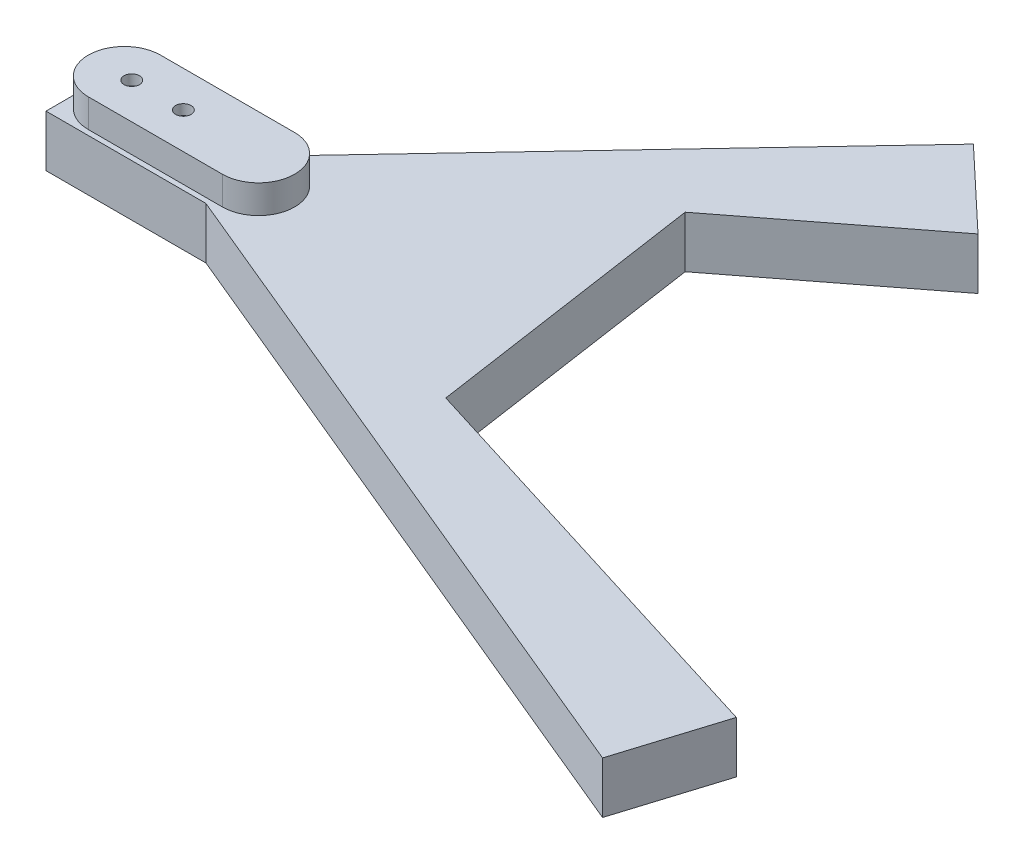
from build123d import *

# Parameters (mm, degrees)
BOSS_EXTRUDE1_DEPTH = 10
BOSS_EXTRUDE2_DEPTH = 5.5
SKETCH3_R           = 1.5
CUT_EXTRUDE1_DEPTH  = 20
CUT_EXTRUDE2_DEPTH  = 13.5


with BuildPart() as part:
    # Sketch1 → Boss-Extrude1 (new body)
    with BuildSketch(Plane(origin=(0, 0, 0), x_dir=(1, 0, 0), z_dir=(0, 1, 0))):
        Polygon((-10.811320755, -11.471698113), (20.188679245, -11.471698113), (151.692912318, -66.106409411), (157.848103065, -46.341402143), (76.084307937, -20.878636135), (68.093699226, 33.50154619), (100.126439745, 58.224515545), (84.598365037, 72.861095688), (20.188679245, 4.528301887), (-10.811320755, 4.528301887), align=None)
    extrude(amount=BOSS_EXTRUDE1_DEPTH)

    # Sketch2 → Boss-Extrude2 (add)
    with BuildSketch(Plane(origin=(0, 10, 0), x_dir=(1, 0, 0), z_dir=(0, 1, 0))):
        with BuildLine():
            Line((-3.616424759, 3.528301887), (22.383575241, 3.528301887))
            ThreePointArc((22.383575241, 3.528301887), (29.383575241, -3.471698113), (22.383575241, -10.471698113))
            Line((22.383575241, -10.471698113), (-3.616424759, -10.471698113))
            ThreePointArc((-3.616424759, -10.471698113), (-10.616424759, -3.471698113), (-3.616424759, 3.528301887))
        make_face()
    extrude(amount=BOSS_EXTRUDE2_DEPTH)

    # Sketch3 → Cut-Extrude1 (cut)
    with BuildSketch(Plane(origin=(0, 15.5, 0), x_dir=(1, 0, 0), z_dir=(0, 1, 0))):
        with Locations((-2.189535813, -3.471698113)):
            Circle(SKETCH3_R)
        with Locations((7.810464187, -3.471698113)):
            Circle(SKETCH3_R)
    extrude(amount=-CUT_EXTRUDE1_DEPTH, mode=Mode.SUBTRACT)

    # Sketch4 → Cut-Extrude2 (cut)
    with BuildSketch(Plane.XZ):
        with BuildLine():
            Line((-2.189535813, 7.971698113), (7.810464187, 7.971698113))
            ThreePointArc((7.810464187, 7.971698113), (12.310464187, 3.471698113), (7.810464187, -1.028301887))
            Line((7.810464187, -1.028301887), (-2.189535813, -1.028301887))
            ThreePointArc((-2.189535813, -1.028301887), (-6.689535813, 3.471698113), (-2.189535813, 7.971698113))
        make_face()
    extrude(amount=-CUT_EXTRUDE2_DEPTH, mode=Mode.SUBTRACT)


solid = part.part
